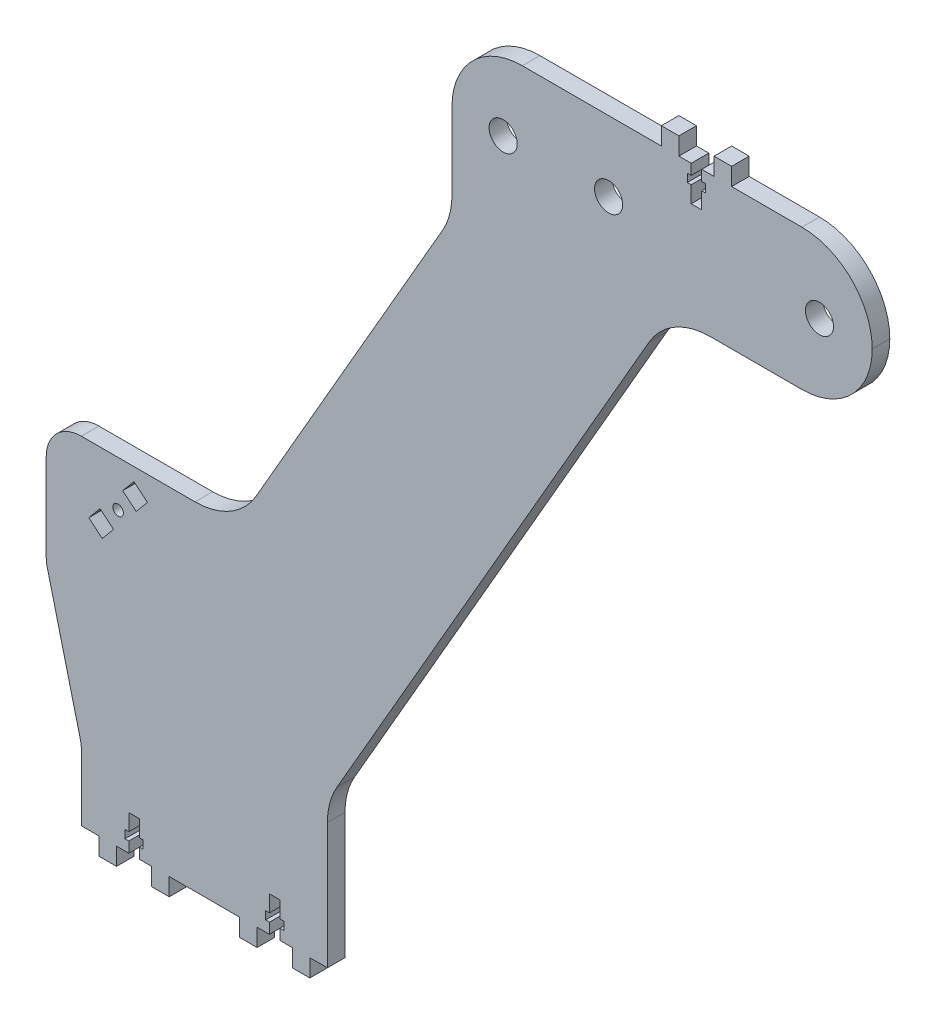
from build123d import *

# Parameters (mm, degrees)
ESQUISSE1_R        = 4
ESQUISSE1_R_2      = 1.5
BOSS_EXTRU_1_DEPTH = 5
CONG_1_R           = 10
CONG_2_R           = 20


with BuildPart() as part:
    # Esquisse1 → Boss.-Extru.1 (new body)
    with BuildSketch(Plane.XY):
        Polygon((-21.5, 0), (-25, 0), (-25, -5), (-30, -5), (-30, 0), (-35, 0), (-35, 20), (-45, 60), (-45, 95.993420768), (-35, 95.993420768), (-10, 95.993420768), (8.893717408, 95.993420768), (70.442895342, 202.763784424), (70.442895342, 250), (97.672831982, 250), (130, 250), (130, 255), (135, 255), (135, 250), (138.5, 250), (138.5, 247), (137.4, 247), (137.4, 244.7), (138.5, 244.7), (138.5, 240), (141.5, 240), (141.5, 244.7), (142.6, 244.7), (142.6, 247), (141.5, 247), (141.5, 250), (145, 250), (145, 255), (150, 255), (150, 250), (190, 250), (190, 210), (132.327168018, 210), (35, 41.164972924), (35, 0), (30, 0), (30, -5), (25, -5), (25, 0), (21.5, 0), (21.5, 3), (22.6, 3), (22.6, 5.3), (21.5, 5.3), (21.5, 10), (18.5, 10), (18.5, 5.3), (17.4, 5.3), (17.4, 3), (18.5, 3), (18.5, 0), (15, 0), (15, -5), (10, -5), (10, 0), (-10, 0), (-10, -5), (-15, -5), (-15, 0), (-18.5, 0), (-18.5, 3), (-17.4, 3), (-17.4, 5.3), (-18.5, 5.3), (-18.5, 10), (-21.5, 10), (-21.5, 5.3), (-22.6, 5.3), (-22.6, 3), (-21.5, 3), align=None)
        with Locations((115, 230)):
            Circle(ESQUISSE1_R, mode=Mode.SUBTRACT)
        with Locations((175, 230)):
            Circle(ESQUISSE1_R, mode=Mode.SUBTRACT)
        with Locations((85, 230)):
            Circle(ESQUISSE1_R, mode=Mode.SUBTRACT)
        with Locations((-24.543125869, 83.023041686)):
            Circle(ESQUISSE1_R_2, mode=Mode.SUBTRACT)
        Polygon((-29.672175025, 80.799788495), (-32.886113073, 76.969566279), (-29.055890858, 73.755628231), (-25.841952809, 77.585850447), align=None, mode=Mode.SUBTRACT)
        Polygon((-23.244298928, 88.460232926), (-20.03036088, 92.290455142), (-16.200138664, 89.076517093), (-19.414076712, 85.246294878), align=None, mode=Mode.SUBTRACT)
    extrude(amount=BOSS_EXTRU_1_DEPTH)

    # Congé1
    cong_1_edges = [part.edges().sort_by_distance(p)[0] for p in [
        (-35, 20, 2.5),
        (-45, 60, 2.5),
        (-45, 95.993420768, 2.5),
    ]]
    fillet(cong_1_edges, radius=CONG_1_R)

    # Congé2
    cong_2_edges = [part.edges().sort_by_distance(p)[0] for p in [
        (35, 41.164972924, 2.5),
        (132.327168018, 210, 2.5),
        (190, 210, 2.5),
        (70.442895342, 250, 2.5),
        (190, 250, 2.5),
        (8.893717408, 95.993420768, 2.5),
        (70.442895342, 202.763784424, 2.5),
    ]]
    fillet(cong_2_edges, radius=CONG_2_R - 0.0001)  # a hair under: the kernel refuses the full size


solid = part.part
